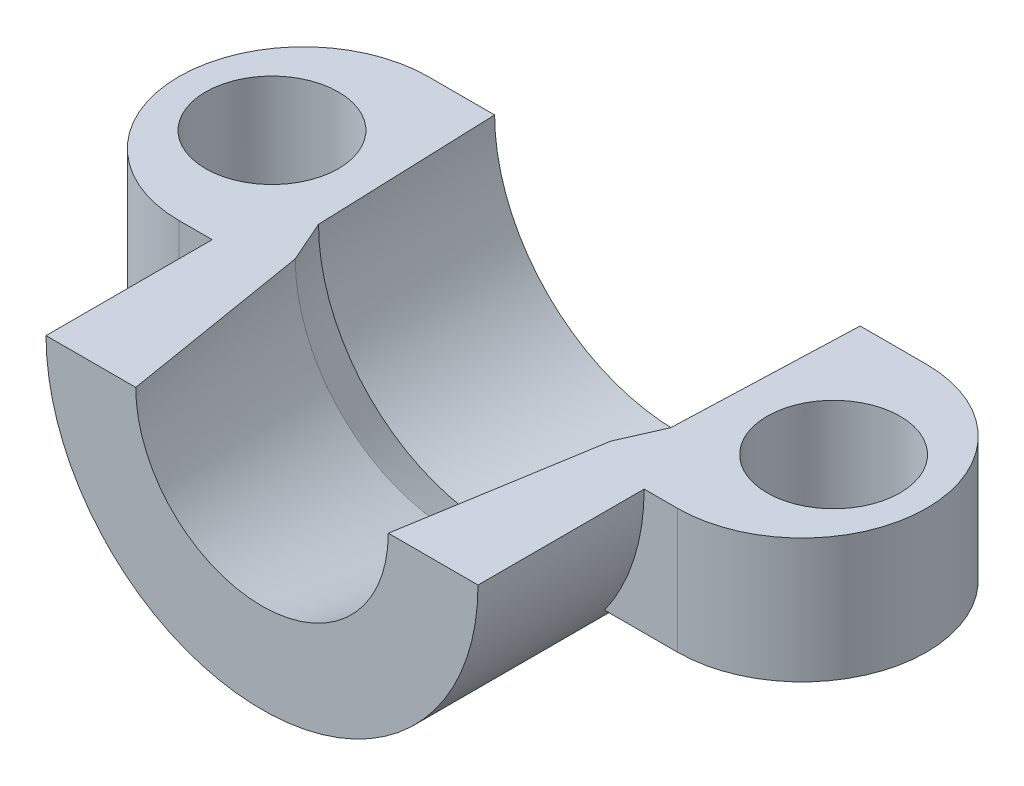
from build123d import *

# Parameters (mm, degrees)
SKETCH1_R             = 13
BOSS_EXTRUDE1_DEPTH   = 25
BOSS_EXTRUDE2_DEPTH   = 7.5
BOSS_EXTRUDE2_2_DEPTH = 7.5
BOSS_EXTRUDE3_DEPTH   = 15
SKETCH5_R             = 3
CUT_EXTRUDE1_DEPTH    = 40.389084782
SKETCH6_R             = 4.45
CUT_EXTRUDE2_DEPTH    = 3
SKETCH7_R             = 4
CUT_EXTRUDE3_DEPTH    = 7.5
SKETCH8_W             = 50
SKETCH8_H             = 50
CUT_EXTRUDE4_DEPTH    = 37.058979464


with BuildPart() as part:
    # Sketch1 → Boss-Extrude1 (new body)
    with BuildSketch(Plane.XY):
        Circle(SKETCH1_R)
    extrude(amount=-BOSS_EXTRUDE1_DEPTH)

    # Sketch2 → Cut-Revolve1 (revolve, cut)
    with BuildSketch(Plane(origin=(0, 0, 0), x_dir=(0, 0, -1), z_dir=(1, 0, 0))):
        Polygon((0, 0), (0, 7.6), (11.5, 9.5), (14, 10.6), (25, 11), (25, 0), align=None)
    revolve(axis=Axis((0, 0, -25), (0, 0, 1)), mode=Mode.SUBTRACT)



with BuildPart() as body_2:
    # Sketch3 → Boss-Extrude2 (new, symmetric)
    with BuildSketch(Plane(origin=(0, 0, 0), x_dir=(1, 0, 0), z_dir=(0, 1, 0))):
        with BuildLine():
            Line((-13, 25), (-13, 10))
            Line((-13, 10), (-15, 10))
            ThreePointArc((-15, 10), (-22.5, 17.5), (-15, 25))
            Line((-15, 25), (-13, 25))
        make_face()
    extrude(amount=BOSS_EXTRUDE2_DEPTH, both=True)


with BuildPart() as body_3:
    # Sketch3 → Boss-Extrude2 2 (new, symmetric)
    with BuildSketch(Plane(origin=(0, 0, 0), x_dir=(1, 0, 0), z_dir=(0, 1, 0))):
        with BuildLine():
            Line((13, 25), (15, 25))
            ThreePointArc((15, 25), (22.5, 17.5), (15, 10))
            Line((15, 10), (13, 10))
            Line((13, 10), (13, 25))
        make_face()
    extrude(amount=BOSS_EXTRUDE2_2_DEPTH, both=True)


with BuildPart() as part_1:
    add(part.part)

    add(body_2.part)  # Boss-Extrude3 merges body 2

    add(body_3.part)  # Boss-Extrude3 merges body 3
    # Sketch4 → Boss-Extrude3 (add)
    with BuildSketch(Plane(origin=(0, 0, -25), x_dir=(-1, 0, 0), z_dir=(0, 0, -1))):
        with BuildLine():
            Line((-13, 7.5), (-13, -7.5))
            Line((-13, -7.5), (-8.04673847, -7.5))
            ThreePointArc((-8.04673847, -7.5), (-11, 0), (-8.04673847, 7.5))
            Line((-8.04673847, 7.5), (-13, 7.5))
        make_face()
        with BuildLine():
            Line((13, 7.5), (13, -7.5))
            Line((13, -7.5), (8.04673847, -7.5))
            ThreePointArc((8.04673847, -7.5), (11, 0), (8.04673847, 7.5))
            Line((8.04673847, 7.5), (13, 7.5))
        make_face()
    extrude(amount=-BOSS_EXTRUDE3_DEPTH)

    # Sketch5 → Cut-Extrude1 (cut, through all)
    with BuildSketch(Plane(origin=(0, 7.5, 0), x_dir=(1, 0, 0), z_dir=(0, 1, 0))):
        with Locations((16.9, 17.5)):
            Circle(SKETCH5_R)
        with Locations((-16.9, 17.5)):
            Circle(SKETCH5_R)
    extrude(amount=-CUT_EXTRUDE1_DEPTH, mode=Mode.SUBTRACT)

    # Sketch6 → Cut-Extrude2 (cut)
    with BuildSketch(Plane(origin=(0, 7.5, 0), x_dir=(1, 0, 0), z_dir=(0, 1, 0))):
        with Locations((-16.9, 17.5)):
            Circle(SKETCH6_R)
        with Locations((16.9, 17.5)):
            Circle(SKETCH6_R)
    extrude(amount=-CUT_EXTRUDE2_DEPTH, mode=Mode.SUBTRACT)

    # Sketch7 → Cut-Extrude3 (cut)
    with BuildSketch(Plane.XZ.offset(7.5)):
        with Locations((-16.9, -17.5)):
            Circle(SKETCH7_R)
        with Locations((16.9, -17.5)):
            Circle(SKETCH7_R)
    extrude(amount=-CUT_EXTRUDE3_DEPTH, mode=Mode.SUBTRACT)

    # Sketch8 → Cut-Extrude4 (cut, through all)
    with BuildSketch(Plane(origin=(0, 0, 0), x_dir=(1, 0, 0), z_dir=(0, 1, 0))):
        with Locations((0, 14.017641389)):
            Rectangle(SKETCH8_W, SKETCH8_H)
    extrude(amount=CUT_EXTRUDE4_DEPTH, mode=Mode.SUBTRACT)


solid = part_1.part
